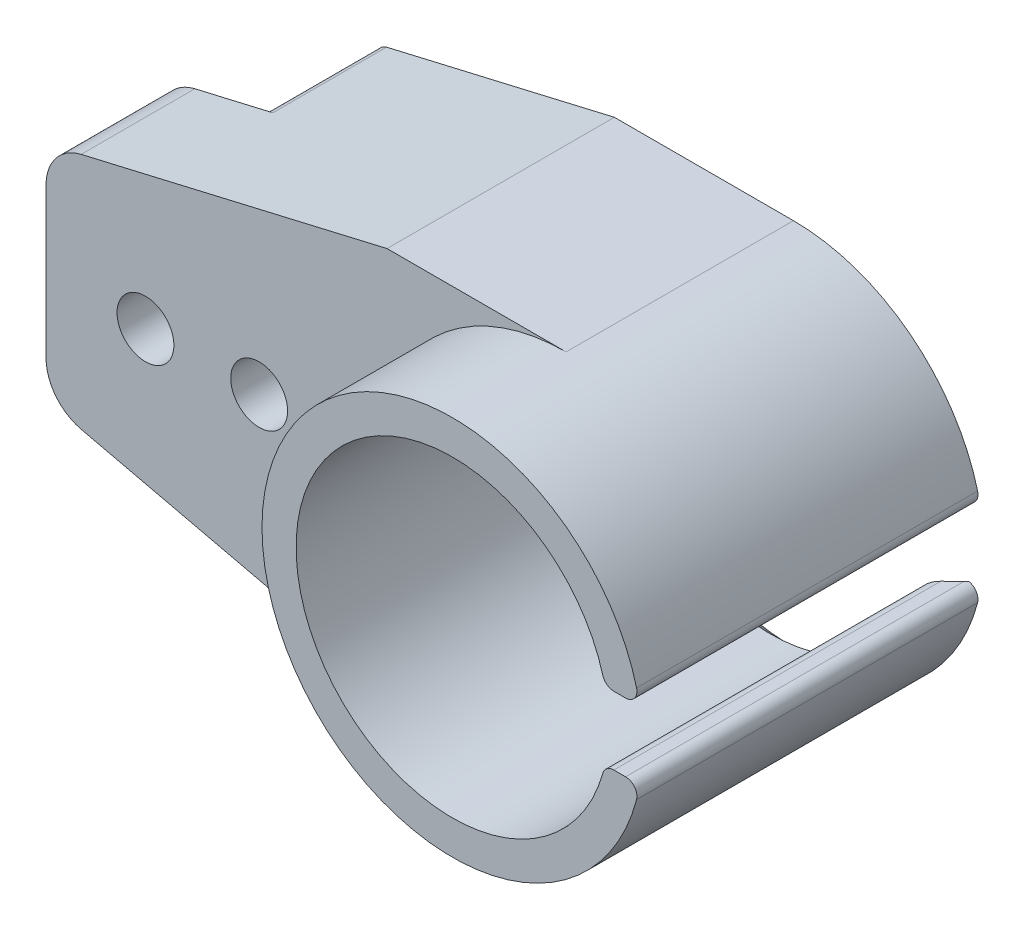
from build123d import *

# Parameters (mm, degrees)
ESQUISSE1_R             = 2.5
BOSS_EXTRU_1_DEPTH      = 30
CHANFREIN1_SIZE         = 2
CONG_2_R                = 1
ENL_V_MAT_EXTRU_1_DEPTH = 10
ENL_V_START             = -10
ENL_V_MAT_EXTRU_2_DEPTH = 10
ENL_V_MAT_EXTRU_3_DEPTH = 53.665216263
CONG_3_R                = 1
CONG_4_R                = 4


with BuildPart() as part:
    # Esquisse1 → Boss.-Extru.1 (new body)
    with BuildSketch(Plane.XY):
        with BuildLine():
            Line((13.4187369, 3), (16.479153498, 3))
            ThreePointArc((16.479153498, 3), (10.731088016, 12.861036117), (0, 16.75))
            Line((0, 16.75), (-45.75, 16.75))
            Line((-45.75, 16.75), (-45.75, -16.75))
            Line((-45.75, -16.75), (0, -16.75))
            ThreePointArc((0, -16.75), (10.731088016, -12.861036117), (16.479153498, -3))
            Line((16.479153498, -3), (13.4187369, -3))
            ThreePointArc((13.4187369, -3), (-13.75, 0), (13.4187369, 3))
        make_face()
        with Locations((-37, 0)):
            Circle(ESQUISSE1_R, mode=Mode.SUBTRACT)
        with Locations((-27, 0)):
            Circle(ESQUISSE1_R, mode=Mode.SUBTRACT)
    extrude(amount=BOSS_EXTRU_1_DEPTH)

    # Chanfrein1
    chanfrein1_edges = [part.edges().sort_by_distance(p)[0] for p in [
        (-13.75, 0, 0),
    ]]
    chamfer(chanfrein1_edges, length=CHANFREIN1_SIZE)

    # Congé2
    # the kernel refuses this fillet: 1 mm, written as the material it takes off along each edge
    with BuildSketch(Plane(origin=(16.479153498, -3, -3.211221849), x_dir=(-1, 0, 0), z_dir=(0, 0, 1))) as cong_2_piece_1:
        with BuildLine():
            CenterArc((1.245555761, 1), CONG_2_R, 165.287542039, 104.712457961)
            ThreePointArc((0.278343206, 1.253968254), (0.127146972, 0.629653233), (0, 0))
            Line((0, 0), (1.245555761, 0))
        make_face()
    extrude(amount=36.422443699, mode=Mode.SUBTRACT)
    with BuildSketch(Plane(origin=(16.479153498, 3, -3.211221849), x_dir=(-1, 0, 0), z_dir=(0, 0, 1))) as cong_2_piece_2:
        with BuildLine():
            CenterArc((1.245555761, -1), CONG_2_R, 90, 104.712457961)
            ThreePointArc((0.278343206, -1.253968254), (0.127146972, -0.629653233), (0, 0))
            Line((0, 0), (1.245555761, 0))
        make_face()
    extrude(amount=36.422443699, mode=Mode.SUBTRACT)
    with BuildSketch(Plane(origin=(13.4187369, -3, 0.05366509), x_dir=(1, 0, 0), z_dir=(0, 0, 1))) as cong_2_piece_3:
        with BuildLine():
            CenterArc((0.778533964, -1), CONG_2_R, 90, 74.265120821)
            ThreePointArc((-0.183992874, -0.728813559), (-0.087015193, -0.365664321), (0, 0))
            Line((0, 0), (0.778533964, 0))
        make_face()
    extrude(amount=31.892669821, mode=Mode.SUBTRACT)
    with BuildSketch(Plane(origin=(13.4187369, 3, 0.05366509), x_dir=(-0.24477558700132723, 0.9695797605190384, 0), z_dir=(0, 0, 1))) as cong_2_piece_4:
        with BuildLine():
            CenterArc((0.779013652, -0.999626362), CONG_2_R, 91.566307169, 74.265120821)
            Line((-0.190566108, -0.754850775), (0, 0))
            ThreePointArc((0, 0), (0.37583992, -0.005137529), (0.75167984, 0))
        make_face()
    extrude(amount=31.892669821, mode=Mode.SUBTRACT)

    # Esquisse2 → Enlèv. mat.-Extru.1 (cut)
    with BuildSketch(Plane(origin=(0, 0, 0), x_dir=(-1, 0, 0), z_dir=(0, 0, -1))):
        with BuildLine():
            Line((45.75, 10.1), (27, 10.1))
            ThreePointArc((27, 10.1), (16.9, 0), (27, -10.1))
            Line((27, -10.1), (45.75, -10.1))
            Line((45.75, -10.1), (45.75, 10.1))
        make_face()
    extrude(amount=-ENL_V_MAT_EXTRU_1_DEPTH, mode=Mode.SUBTRACT)

    # Esquisse3 → Enlèv. mat.-Extru.2 (cut)
    with BuildSketch(Plane.XY.offset(30).offset(ENL_V_START)):
        with BuildLine():
            Line((0, 16.75), (-45.75, 16.75))
            Line((-45.75, 16.75), (-45.75, -16.75))
            Line((-45.75, -16.75), (0, -16.75))
            ThreePointArc((0, -16.75), (-16.75, 0), (0, 16.75))
        make_face()
    extrude(amount=ENL_V_MAT_EXTRU_2_DEPTH, mode=Mode.SUBTRACT)

    # Esquisse5 → Enlèv. mat.-Extru.3 (cut, through all)
    with BuildSketch(Plane.XY.offset(20)):
        Polygon((-15.75, 16.75), (-45.75, 9.75), (-45.75, 16.75), align=None)
        Polygon((-45.75, -16.75), (-15.75, -16.75), (-45.75, -9.75), align=None)
    extrude(amount=-ENL_V_MAT_EXTRU_3_DEPTH, mode=Mode.SUBTRACT)

    # Congé3
    cong_3_edges = [part.edges().sort_by_distance(p)[0] for p in [
        (-44.25, 10.1, 5),
        (-44.25, -10.1, 5),
    ]]
    fillet(cong_3_edges, radius=CONG_3_R)

    # Congé4
    cong_4_edges = [part.edges().sort_by_distance(p)[0] for p in [
        (-45.75, 9.75, 15),
        (-45.75, -9.75, 15),
    ]]
    fillet(cong_4_edges, radius=CONG_4_R)


solid = part.part
